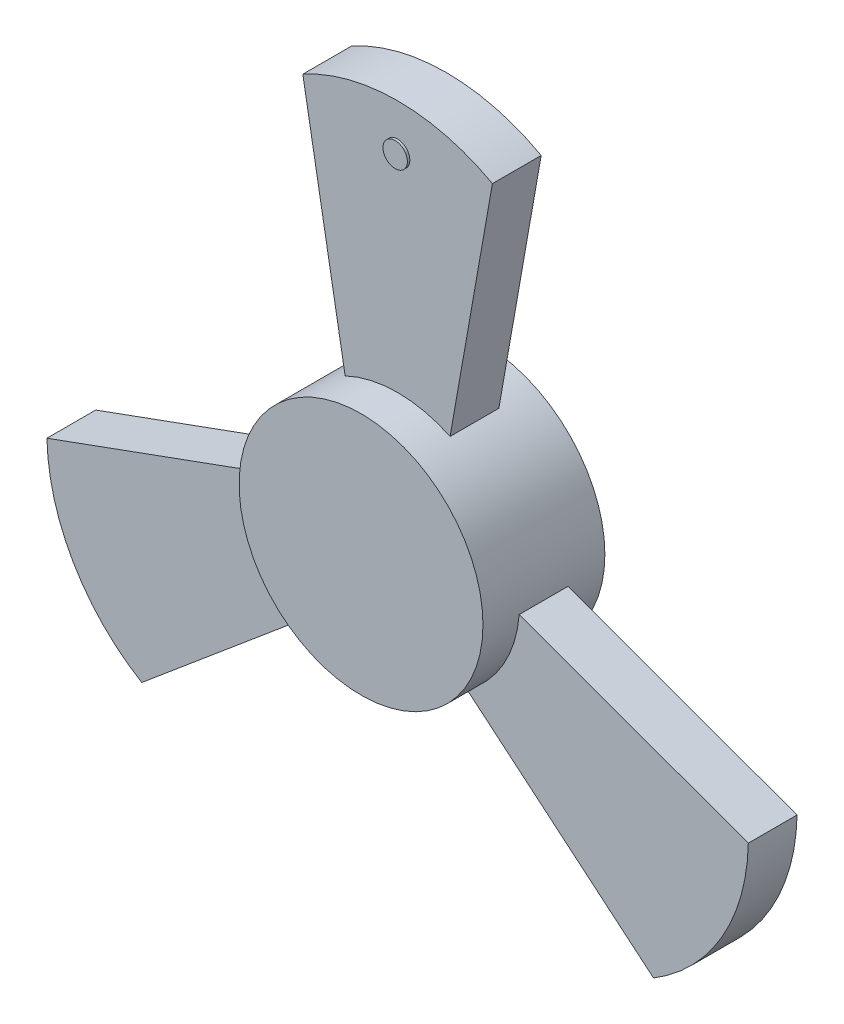
from build123d import *

# Parameters (mm, degrees)
SKETCH1_R           = 50
BOSS_EXTRUDE1_DEPTH = 25
BOSS_EXTRUDE2_DEPTH = 10
SKETCH3_R           = 5
BOSS_EXTRUDE3_DEPTH = 1


with BuildPart() as part:
    # Sketch1 → Boss-Extrude1 (new, symmetric)
    with BuildSketch(Plane.XY):
        Circle(SKETCH1_R)
    extrude(amount=BOSS_EXTRUDE1_DEPTH, both=True)

    # Sketch2 → Boss-Extrude2 (add, symmetric)
    with BuildSketch(Plane.XY):
        with BuildLine():
            Line((-21.510823847, 45.13628759), (-38.875641614, 143.617062891))
            ThreePointArc((-38.875641614, 143.617062891), (0, 153.617062891), (38.875641614, 143.617062891))
            Line((38.875641614, 143.617062891), (21.510823847, 45.13628759))
            ThreePointArc((21.510823847, 45.13628759), (0, 50), (-21.510823847, 45.13628759))
        make_face()
        with BuildLine():
            Line((104.938204074, -105.475824672), (28.333759762, -41.197063703))
            ThreePointArc((28.333759762, -41.197063703), (43.301270189, -25), (49.844583609, -3.939223887))
            Line((49.844583609, -3.939223887), (143.813845688, -38.14123822))
            ThreePointArc((143.813845688, -38.14123822), (133.036278919, -76.808531446), (104.938204074, -105.475824672))
        make_face()
        with BuildLine():
            Line((-143.813845688, -38.14123822), (-49.844583609, -3.939223887))
            ThreePointArc((-49.844583609, -3.939223887), (-43.301270189, -25), (-28.333759762, -41.197063703))
            Line((-28.333759762, -41.197063703), (-104.938204074, -105.475824672))
            ThreePointArc((-104.938204074, -105.475824672), (-133.036278919, -76.808531446), (-143.813845688, -38.14123822))
        make_face()
    extrude(amount=BOSS_EXTRUDE2_DEPTH, both=True)

    # Sketch3 → Boss-Extrude3 (add, symmetric)
    with BuildSketch(Plane.XY.offset(10)):
        with Locations((0, 135)):
            Circle(SKETCH3_R)
    extrude(amount=BOSS_EXTRUDE3_DEPTH, both=True)


solid = part.part
